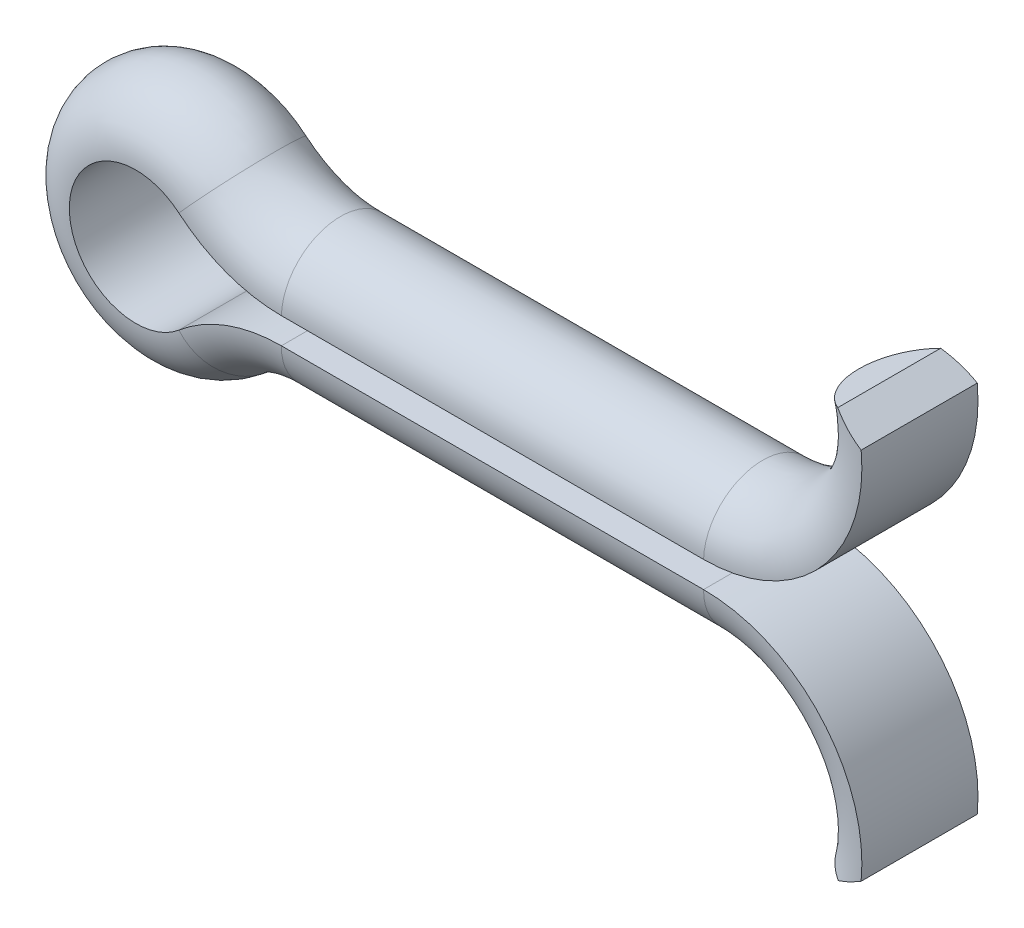
from build123d import *

# Parameters (mm, degrees)
CHAMFER1_SIZE   = 0.490386288
CHAMFER1_SIZE_2 = 0.5


with BuildPart() as part:
    # Sweep1: sweep along a path in Sketch2
    with BuildLine(Plane.XY) as sweep1_path:
        ThreePointArc((13.661432431, 4), (13.13002069, 1.41121807), (10.757422857, 0.24718635))
        Line((10.757422857, 0.24718635), (2.757422857, 0.24718635))
        ThreePointArc((2.757422857, 0.24718635), (1.723075925, 0.431138334), (0.815575775, 0.960435399))
        ThreePointArc((0.815575775, 0.960435399), (-1.26, 0), (0.815575775, -0.960435399))
        ThreePointArc((0.815575775, -0.960435399), (1.723075925, -0.431138334), (2.757422857, -0.24718635))
        Line((2.757422857, -0.24718635), (10.757422857, -0.24718635))
        ThreePointArc((10.757422857, -0.24718635), (13.13002069, -1.41121807), (13.661432431, -4))
    # Sketch3 → Sweep1 (sweep)
    with BuildSketch(Plane(origin=(-0.043758, -0.15601294, 0), x_dir=(-0.9628447435084047, 0.2700555496527233, 0), z_dir=(-0.2700555496527233, -0.9628447435084047, 0))):
        with BuildLine():
            Line((-14.234060604, 0), (-14.234060604, 1.1))
            ThreePointArc((-14.234060604, 1.1), (-13.144060604, 0), (-14.234060604, -1.1))
            Line((-14.234060604, -1.1), (-14.234060604, 0))
        make_face()
    sweep(path=sweep1_path.line)

    # Chamfer1
    # the kernel refuses this chamfer: 0.510202238, 0.5, 0.490386288 mm, written as the material it takes off along each edge
    with BuildSketch(Plane(origin=(13.661432431, -4, 2.361129393), x_dir=(0.175111049870281, 0.9845486885945905, 0), z_dir=(0, 0, -1))) as chamfer1_piece_1:
        with BuildLine():
            Line((0.465315054, 0), (CHAMFER1_SIZE * 0.0972780834523, -CHAMFER1_SIZE * 0.995257241304))
            Line((CHAMFER1_SIZE * 0.0972780834523, -CHAMFER1_SIZE * 0.995257241304), (0, 0))
            ThreePointArc((0, 0), (0.23916202, 0.009028142), (0.465315054, 0))
        make_face()
    extrude(amount=4.722258787, mode=Mode.SUBTRACT)
    with BuildSketch(Plane(origin=(13.661432431, 4, -2.386582655), x_dir=(0.17386319969755534, -0.9847698146221421, 0), z_dir=(0, 0, 1))) as chamfer1_piece_2:
        with BuildLine():
            Line((0.472895525, 0), (CHAMFER1_SIZE_2 * 0.0590616527059, -CHAMFER1_SIZE_2 * 0.99825433692))
            Line((CHAMFER1_SIZE_2 * 0.0590616527059, -CHAMFER1_SIZE_2 * 0.99825433692), (0, 0))
            ThreePointArc((0, 0), (0.243228199, 0.009324777), (0.472895525, 0))
        make_face()
    extrude(amount=4.773165311, mode=Mode.SUBTRACT)


solid = part.part
